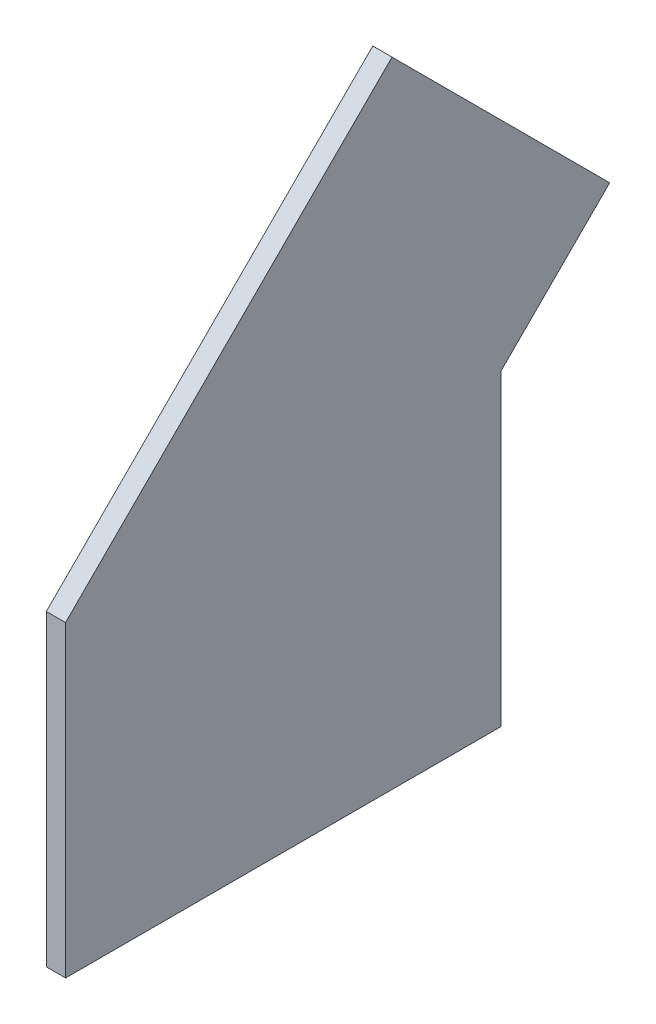
from build123d import *

# Parameters (mm, degrees)
BOSS_EXTRUDE1_DEPTH = 3.175


with BuildPart() as part:
    # Sketch1 → Boss-Extrude1 (new body)
    with BuildSketch(Plane(origin=(0, 0, 0), x_dir=(0, 0, -1), z_dir=(1, 0, 0))):
        Polygon((0, 0), (0, 50.8), (17.960512242, 68.760512242), (-17.960512242, 104.681536726), (-71.842048969, 50.8), (-71.842048969, 0), align=None)
    extrude(amount=BOSS_EXTRUDE1_DEPTH)


solid = part.part
